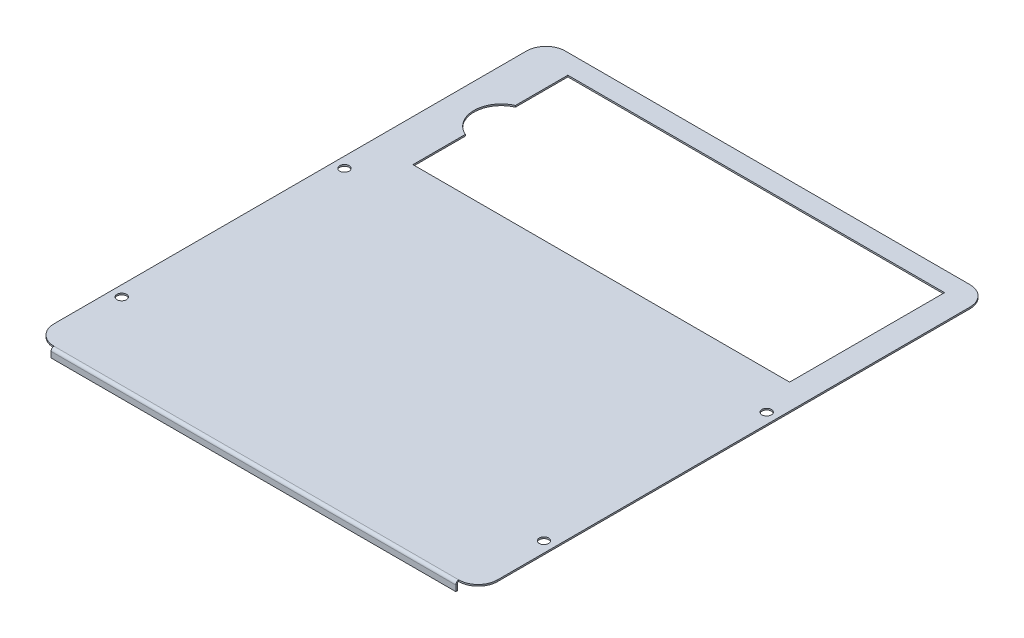
from build123d import *

# Parameters (mm, degrees)
BASE_FLANGE1_DEPTH      = 114.5
BASE_FLANGE1_DEPTH_BACK = 114.5
SKETCH1_W               = 264
SKETCH1_H               = 0.8
FILLET1_R               = 10
EDGE_FLANGE2_DEPTH      = 209
SKETCH14_R              = 2.45
CUT_EXTRUDE1_DEPTH      = 176.961710436
CUT_EXTRUDE2_DEPTH      = 176.961710436


# Sheet-metal steps are written as plain solids
with BuildPart() as part:
    # Sketch1 → Base-Flange1 (new, two sides: drawn at the far end of the back side and taken through both)
    with BuildSketch(Plane(origin=(0, 0, 0), x_dir=(0, 0, -1), z_dir=(1, 0, 0)).offset(-BASE_FLANGE1_DEPTH_BACK)):
        with Locations((0, -0.4)):
            Rectangle(SKETCH1_W, SKETCH1_H)
    extrude(amount=BASE_FLANGE1_DEPTH + BASE_FLANGE1_DEPTH_BACK)

    # Fillet1
    fillet1_edges = [part.edges().sort_by_distance(p)[0] for p in [
        (-114.5, -0.4, 132),
        (-114.5, -0.4, -132),
        (114.5, -0.4, 132),
        (114.5, -0.4, -132),
    ]]
    fillet(fillet1_edges, radius=FILLET1_R)

    # Edge-Flange2 section (across the edge) → Edge-Flange2 (add)
    with BuildSketch(Plane(origin=(104.5, -0.8, 132.7366), x_dir=(0, 0, -1), z_dir=(-1, 0, 0))):
        with BuildLine():
            Line((-0.8, 0.7366), (-0.8, 3.7))
            Line((-0.8, 3.7), (0, 3.7))
            Line((0, 3.7), (0, 0.7366))
            ThreePointArc((0, 0.7366), (0.215745145, 0.215745145), (0.7366, 0))
            Line((0.7366, 0), (0.7366, -0.8))
            ThreePointArc((0.7366, -0.8), (-0.34994028, -0.34994028), (-0.8, 0.7366))
        make_face()
    extrude(amount=EDGE_FLANGE2_DEPTH)

    # Sketch14 → Cut-Extrude1 (cut, through all)
    with BuildSketch(Plane(origin=(0, 0, 0), x_dir=(1, 0, 0), z_dir=(0, 1, 0))):
        with Locations(Location((-109, -92.5, 0), (0, 0, 270))):
            Circle(SKETCH14_R)
        with Locations(Location((-109, 22.5, 0), (0, 0, 270))):
            Circle(SKETCH14_R)
    cut_extrude1 = extrude(amount=-CUT_EXTRUDE1_DEPTH, mode=Mode.SUBTRACT)

    # Mirror1: Cut-Extrude1 across plane
    add(cut_extrude1.mirror(Plane(origin=(0, 0, 0), x_dir=(0, 0, 1), z_dir=(1, 0, 0))), mode=Mode.SUBTRACT)

    # Sketch15 → Cut-Extrude2 (cut, through all)
    with BuildSketch(Plane(origin=(0, 0, 0), x_dir=(1, 0, 0), z_dir=(0, 1, 0))):
        with BuildLine():
            Line((-93, 121.85), (101.5, 121.85))
            Line((101.5, 121.85), (101.5, 41.85))
            Line((101.5, 41.85), (-93, 41.85))
            Line((-93, 41.85), (-93, 68.9))
            ThreePointArc((-93, 68.9), (-101.5, 81.85), (-93, 94.8))
            Line((-93, 94.8), (-93, 121.85))
        make_face()
    extrude(amount=-CUT_EXTRUDE2_DEPTH, mode=Mode.SUBTRACT)


solid = part.part
